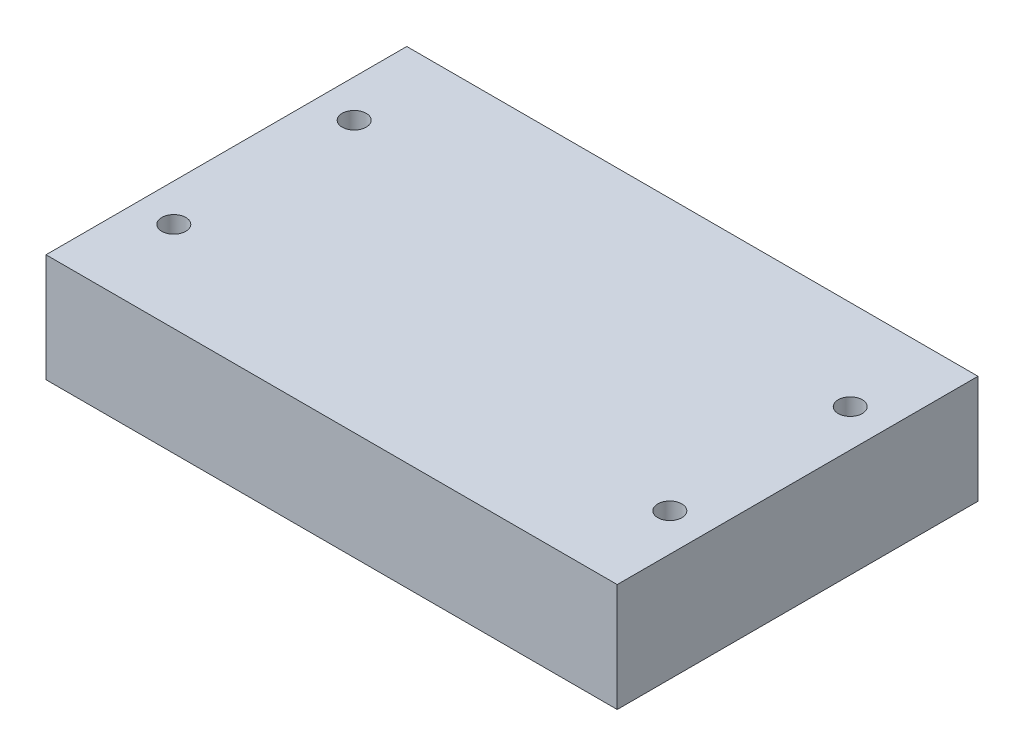
from build123d import *

# Parameters (mm, degrees)
ESQUISSE1_W        = 95
ESQUISSE1_H        = 60
ESQUISSE1_R        = 2
BOSS_EXTRU_1_DEPTH = 18


with BuildPart() as part:
    # Esquisse1 → Boss.-Extru.1 (new body)
    with BuildSketch(Plane(origin=(0, 0, 0), x_dir=(1, 0, 0), z_dir=(0, 1, 0))):
        with Locations((-4.691291333, 5.016095971)):
            Rectangle(ESQUISSE1_W, ESQUISSE1_H)
        with Locations((-45.941291333, 20.016095971)):
            Circle(ESQUISSE1_R, mode=Mode.SUBTRACT)
        with Locations((36.558708667, 20.016095971)):
            Circle(ESQUISSE1_R, mode=Mode.SUBTRACT)
        with Locations((36.558708667, -9.983904029)):
            Circle(ESQUISSE1_R, mode=Mode.SUBTRACT)
        with Locations((-45.941291333, -9.983904029)):
            Circle(ESQUISSE1_R, mode=Mode.SUBTRACT)
    extrude(amount=BOSS_EXTRU_1_DEPTH)


solid = part.part
